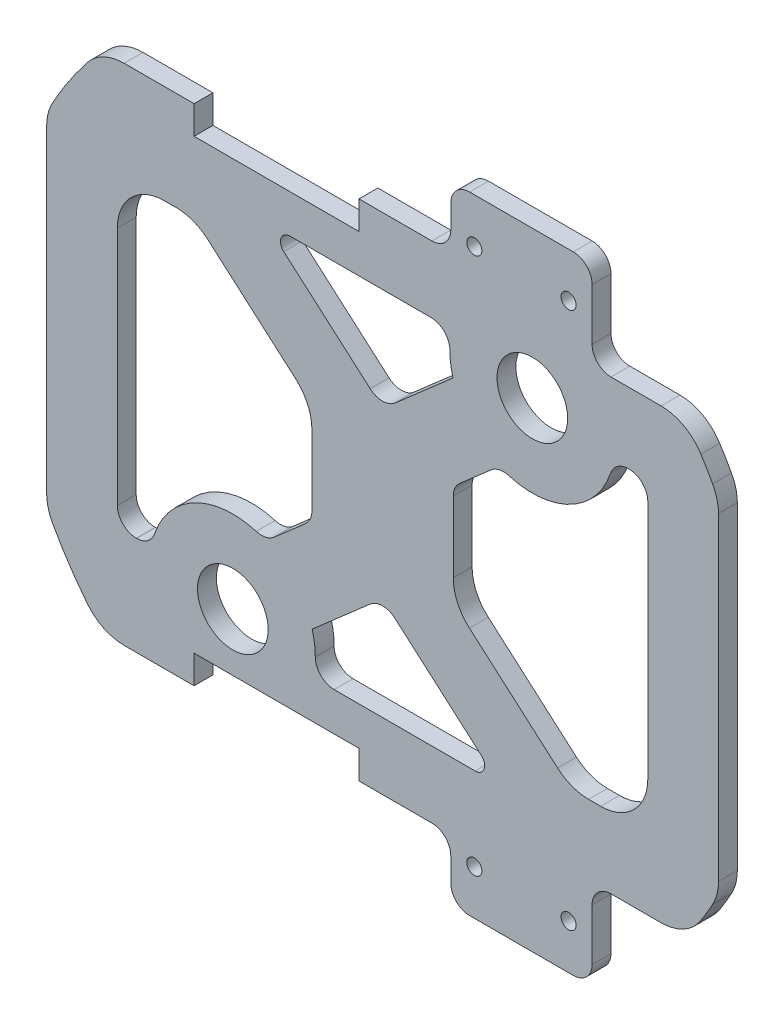
from build123d import *

# Parameters (mm, degrees)
ESBO_O1_R                = 1.6
ESBO_O1_R_2              = 7.5
RESSALTO_EXTRUS_O1_DEPTH = 4
FILETE2_R                = 10
FILETE3_R                = 4
FILETE4_R                = 2


with BuildPart() as part:
    # Esboço1 → Ressalto-extrusão1 (new body)
    with BuildSketch(Plane.XY):
        with BuildLine():
            Line((14.471901241, -53.5), (14.471901241, -66.5))
            Line((14.471901241, -66.5), (44.471901241, -66.5))
            Line((44.471901241, -66.5), (44.471901241, -47.5))
            Line((44.471901241, -47.5), (64.371965948, -47.5))
            ThreePointArc((64.371965948, -47.5), (68.06268346, -42.041302552), (71.291651246, -36.297389198))
            Line((71.291651246, -36.297389198), (71.291651246, 36.297389198))
            ThreePointArc((71.291651246, 36.297389198), (68.06268346, 42.041302552), (64.371965948, 47.5))
            Line((64.371965948, 47.5), (44.471901241, 47.5))
            Line((44.471901241, 47.5), (44.471901241, 66.5))
            Line((44.471901241, 66.5), (14.471901241, 66.5))
            Line((14.471901241, 66.5), (14.471901241, 53.5))
            Line((14.471901241, 53.5), (-5.003543323, 53.5))
            Line((-5.003543323, 53.5), (-5.003543323, 47.5))
            Line((-5.003543323, 47.5), (-40.003543323, 47.5))
            Line((-40.003543323, 47.5), (-40.003543323, 53.5))
            Line((-40.003543323, 53.5), (-59.478987886, 53.5))
            ThreePointArc((-59.478987886, 53.5), (-65.948635083, 45.285511266), (-71.291651246, 36.297389198))
            Line((-71.291651246, 36.297389198), (-71.291651246, -36.297389198))
            ThreePointArc((-71.291651246, -36.297389198), (-65.948635083, -45.285511266), (-59.478987886, -53.5))
            Line((-59.478987886, -53.5), (-40.003543323, -53.5))
            Line((-40.003543323, -53.5), (-40.003543323, -47.5))
            Line((-40.003543323, -47.5), (-5.003543323, -47.5))
            Line((-5.003543323, -47.5), (-5.003543323, -53.5))
            Line((-5.003543323, -53.5), (14.471901241, -53.5))
        make_face()
        with BuildLine():
            Line((25, -39.332538239), (-14.754798134, -39.332538239))
            ThreePointArc((-14.754798134, -39.332538239), (-14.287636143, -34.928412284), (-14.941054623, -30.548045856))
            Line((-14.941054623, -30.548045856), (0, -17.5))
            Line((0, -17.5), (25, -39.332538239))
        make_face(mode=Mode.SUBTRACT)
        with BuildLine():
            Line((-15, -10.684767074), (-24.807750727, -19.249890785))
            ThreePointArc((-24.807750727, -19.249890785), (-40.174599446, -19.942202702), (-49.058352164, -32.5))
            Line((-49.058352164, -32.5), (-56.291651246, -32.5))
            Line((-56.291651246, -32.5), (-56.291651246, 32.5))
            Line((-56.291651246, 32.5), (-39.980184035, 32.5))
            Line((-39.980184035, 32.5), (-15, 10.684767074))
            Line((-15, 10.684767074), (-15, -10.684767074))
        make_face(mode=Mode.SUBTRACT)
        with Locations((19.471901241, -57)):
            Circle(ESBO_O1_R, mode=Mode.SUBTRACT)
        with Locations((39.471901241, -57)):
            Circle(ESBO_O1_R, mode=Mode.SUBTRACT)
        with BuildLine():
            Line((49.058352164, 32.5), (56.291651246, 32.5))
            Line((56.291651246, 32.5), (56.291651246, -32.5))
            Line((56.291651246, -32.5), (39.980184035, -32.5))
            Line((39.980184035, -32.5), (15, -10.684767074))
            Line((15, -10.684767074), (15, 10.684767074))
            Line((15, 10.684767074), (24.807750727, 19.249890785))
            ThreePointArc((24.807750727, 19.249890785), (40.174599446, 19.942202702), (49.058352164, 32.5))
        make_face(mode=Mode.SUBTRACT)
        with BuildLine():
            Line((-25, 39.332538239), (14.754798134, 39.332538239))
            ThreePointArc((14.754798134, 39.332538239), (14.287636143, 34.928412284), (14.941054623, 30.548045856))
            Line((14.941054623, 30.548045856), (0, 17.5))
            Line((0, 17.5), (-25, 39.332538239))
        make_face(mode=Mode.SUBTRACT)
        with Locations((19.471901241, 57)):
            Circle(ESBO_O1_R, mode=Mode.SUBTRACT)
        with Locations((39.471901241, 57)):
            Circle(ESBO_O1_R, mode=Mode.SUBTRACT)
        with Locations((-31.783703802, -35.29937921)):
            Circle(ESBO_O1_R_2, mode=Mode.SUBTRACT)
        with Locations((31.783703802, 35.29937921)):
            Circle(ESBO_O1_R_2, mode=Mode.SUBTRACT)
    extrude(amount=RESSALTO_EXTRUS_O1_DEPTH)

    # Filete2
    filete2_edges = [part.edges().sort_by_distance(p)[0] for p in [
        (39.980184035, -32.5, 2),
        (15, -10.684767074, 2),
        (-15, 10.684767074, 2),
        (-39.980184035, 32.5, 2),
        (-71.291651246, -36.297389198, 2),
        (-71.291651246, 36.297389198, 2),
        (-56.291651246, 32.5, 2),
        (56.291651246, -32.5, 2),
        (71.291651246, -36.297389198, 2),
        (71.291651246, 36.297389198, 2),
        (64.371965948, 47.5, 2),
        (64.371965948, -47.5, 2),
        (-59.478987886, 53.5, 2),
        (-59.478987886, -53.5, 2),
    ]]
    fillet(filete2_edges, radius=FILETE2_R)

    # Filete3
    filete3_edges = [part.edges().sort_by_distance(p)[0] for p in [
        (49.058352164, 32.5, 2),
        (24.807750727, 19.249890785, 2),
        (15, 10.684767074, 2),
        (-15, -10.684767074, 2),
        (-24.807750727, -19.249890785, 2),
        (-49.058352164, -32.5, 2),
        (14.754798134, 39.332538239, 2),
        (0, 17.5, 2),
        (0, -17.5, 2),
        (-14.754798134, -39.332538239, 2),
        (14.471901241, 53.5, 2),
        (14.471901241, -53.5, 2),
        (44.471901241, -47.5, 2),
        (44.471901241, 47.5, 2),
        (14.471901241, -66.5, 2),
        (14.471901241, 66.5, 2),
        (44.471901241, 66.5, 2),
        (44.471901241, -66.5, 2),
        (-56.291651246, -32.5, 2),
        (56.291651246, 32.5, 2),
    ]]
    fillet(filete3_edges, radius=FILETE3_R)

    # Filete4
    filete4_edges = [part.edges().sort_by_distance(p)[0] for p in [
        (25, -39.332538239, 2),
        (-25, 39.332538239, 2),
    ]]
    fillet(filete4_edges, radius=FILETE4_R)


solid = part.part
